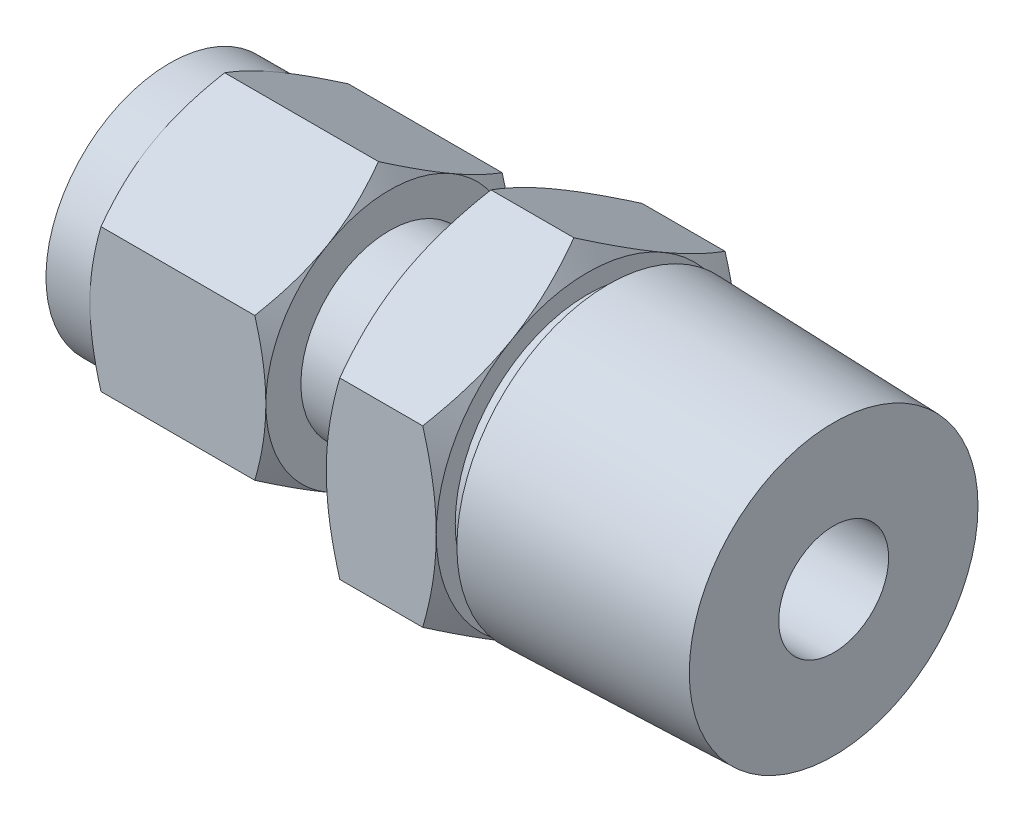
from build123d import *

# Parameters (mm, degrees)
EXTRUDE6_START     = 6.35
SKETCH16_R         = 2.921
EXTRUDE6_DEPTH     = 6.35
SKETCH17_OUTSIDE_W = 48.222
SKETCH17_OUTSIDE_H = 50.9
SKETCH17_OUTSIDE_R = 8.73125
EXTRUDE7_DEPTH     = 6.35
EXTRUDE7_DRAFT     = -60
SKETCH18_OUTSIDE_W = 48.222
SKETCH18_OUTSIDE_H = 50.9
SKETCH18_OUTSIDE_R = 8.73125
EXTRUDE8_DEPTH     = 6.35
EXTRUDE8_DRAFT     = -60
EXTRUDE1_START     = -10.16
SKETCH6_R          = 2.921
EXTRUDE1_DEPTH     = 10.16
SKETCH8_OUTSIDE_W  = 33.698
SKETCH8_OUTSIDE_H  = 36.376
SKETCH8_OUTSIDE_R  = 7.14375
EXTRUDE2_DEPTH     = 1.524
EXTRUDE2_DRAFT     = -60
SKETCH9_OUTSIDE_W  = 50.416
SKETCH9_OUTSIDE_H  = 53.094
SKETCH9_OUTSIDE_R  = 7.14375
EXTRUDE3_DEPTH     = 6.35
EXTRUDE3_DRAFT     = -60
SKETCH15_R         = 3.175
EXTRUDE5_DEPTH     = 15.24


with BuildPart() as part:
    # Sketch5 → Revolve1 (revolve)
    with BuildSketch(Plane.XY):
        Polygon((-7.38378, -3.175), (-7.38378, -2.921), (-14.224, -2.921), (-14.224, -7.63397), (-13.660154017, -7.63397), (-13.02004, -8.74268), (0, -8.338058049), (0, -3.175), align=None)
    revolve(axis=Axis((0, 0, 0), (-1, 0, 0)))

    # Sketch16 → Extrude6 (add)
    with BuildSketch(Plane.ZY.offset(14.224).offset(EXTRUDE6_START)):
        Polygon((0, 10.081979076), (-8.73125, 5.040989538), (-8.73125, -5.040989538), (0, -10.081979076), (8.73125, -5.040989538), (8.73125, 5.040989538), align=None)
        Circle(SKETCH16_R, mode=Mode.SUBTRACT)
    extrude(amount=-EXTRUDE6_DEPTH)


with BuildPart() as extrude7_tool:
    # Sketch17 outside → Extrude7 (with draft: the straight prism first)
    with BuildSketch(Plane.ZY.offset(20.574)):
        Rectangle(SKETCH17_OUTSIDE_W, SKETCH17_OUTSIDE_H)
        Circle(SKETCH17_OUTSIDE_R, mode=Mode.SUBTRACT)
    extrude(amount=-EXTRUDE7_DEPTH)
    # Extrude7: the draft: its side faces are tilted about the plane it starts from
    extrude7_sides = [extrude7_tool.faces().sort_by_distance(p)[0] for p in [
        (-17.399, -25.45, 0),
        (-17.399, 0, 24.111),
        (-17.399, 25.45, 0),
        (-17.399, 0, -24.111),
        (-17.399, 0, -8.73125),
    ]]
    draft(extrude7_sides, Plane.ZY.offset(20.574), EXTRUDE7_DRAFT)


with BuildPart() as part_1:
    add(part.part)

    # Extrude7: cut by extrude7_tool
    add(extrude7_tool.part, mode=Mode.SUBTRACT)


with BuildPart() as extrude8_tool:
    # Sketch18 outside → Extrude8 (with draft: the straight prism first)
    with BuildSketch(Plane(origin=(-14.224, 0, 0), x_dir=(0, 0, -1), z_dir=(1, 0, 0))):
        Rectangle(SKETCH18_OUTSIDE_W, SKETCH18_OUTSIDE_H)
        Circle(SKETCH18_OUTSIDE_R, mode=Mode.SUBTRACT)
    extrude(amount=-EXTRUDE8_DEPTH)
    # Extrude8: the draft: its side faces are tilted about the plane it starts from
    extrude8_sides = [extrude8_tool.faces().sort_by_distance(p)[0] for p in [
        (-17.399, -25.45, 0),
        (-17.399, 0, -24.111),
        (-17.399, 25.45, 0),
        (-17.399, 0, 24.111),
        (-17.399, 0, 8.73125),
    ]]
    draft(extrude8_sides, Plane(origin=(-14.224, 0, 0), x_dir=(0, 0, -1), z_dir=(1, 0, 0)), EXTRUDE8_DRAFT)


with BuildPart() as part_2:
    add(part_1.part)

    # Extrude8: cut by extrude8_tool
    add(extrude8_tool.part, mode=Mode.SUBTRACT)



with BuildPart() as body_2:
    # Sketch6 → Extrude1 (new body)
    with BuildSketch(Plane(origin=(-25.654, 0, 0), x_dir=(0, 0, -1), z_dir=(1, 0, 0)).offset(EXTRUDE1_START)):
        Polygon((0, -8.248891971), (7.14375, -4.124445986), (7.14375, 4.124445986), (0, 8.248891971), (-7.14375, 4.124445986), (-7.14375, -4.124445986), align=None)
        Circle(SKETCH6_R, mode=Mode.SUBTRACT)
    extrude(amount=EXTRUDE1_DEPTH)


with BuildPart() as extrude2_tool:
    # Sketch8 outside → Extrude2 (with draft: the straight prism first)
    with BuildSketch(Plane.ZY.offset(35.814)):
        Rectangle(SKETCH8_OUTSIDE_W, SKETCH8_OUTSIDE_H)
        Circle(SKETCH8_OUTSIDE_R, mode=Mode.SUBTRACT)
    extrude(amount=-EXTRUDE2_DEPTH)
    # Extrude2: the draft: its side faces are tilted about the plane it starts from
    extrude2_sides = [extrude2_tool.faces().sort_by_distance(p)[0] for p in [
        (-35.052, -18.188, 0),
        (-35.052, 0, 16.849),
        (-35.052, 18.188, 0),
        (-35.052, 0, -16.849),
        (-35.052, 0, -7.14375),
    ]]
    draft(extrude2_sides, Plane.ZY.offset(35.814), EXTRUDE2_DRAFT)


with BuildPart() as body_2_1:
    add(body_2.part)

    # Extrude2: cut by extrude2_tool
    add(extrude2_tool.part, mode=Mode.SUBTRACT)


with BuildPart() as extrude3_tool:
    # Sketch9 outside → Extrude3 (with draft: the straight prism first)
    with BuildSketch(Plane(origin=(-25.654, 0, 0), x_dir=(0, 0, -1), z_dir=(1, 0, 0))):
        Rectangle(SKETCH9_OUTSIDE_W, SKETCH9_OUTSIDE_H)
        Circle(SKETCH9_OUTSIDE_R, mode=Mode.SUBTRACT)
    extrude(amount=-EXTRUDE3_DEPTH)
    # Extrude3: the draft: its side faces are tilted about the plane it starts from
    extrude3_sides = [extrude3_tool.faces().sort_by_distance(p)[0] for p in [
        (-28.829, -26.547, 0),
        (-28.829, 0, -25.208),
        (-28.829, 26.547, 0),
        (-28.829, 0, 25.208),
        (-28.829, 0, 7.14375),
    ]]
    draft(extrude3_sides, Plane(origin=(-25.654, 0, 0), x_dir=(0, 0, -1), z_dir=(1, 0, 0)), EXTRUDE3_DRAFT)


with BuildPart() as body_2_2:
    add(body_2_1.part)

    # Extrude3: cut by extrude3_tool
    add(extrude3_tool.part, mode=Mode.SUBTRACT)


with BuildPart() as part_3:
    add(part_2.part)

    add(body_2_2.part)  # Revolve2 merges body 2
    # Sketch11 → Revolve2 (revolve)
    with BuildSketch(Plane.XY):
        Polygon((-21.462977322, 4.49834), (-21.88972, 5.23748), (-30.734, 4.962627555), (-30.734, 7.14375), (-38.354, 7.14375), (-38.354, 2.921), (-14.224, 2.921), (-14.224, 4.49834), align=None)
    revolve(axis=Axis((0, 0, 0), (-1, 0, 0)))

    # Sketch15 → Extrude5 (cut)
    with BuildSketch(Plane.ZY.offset(38.354)):
        Circle(SKETCH15_R)
    extrude(amount=-EXTRUDE5_DEPTH, mode=Mode.SUBTRACT)


solid = part_3.part
